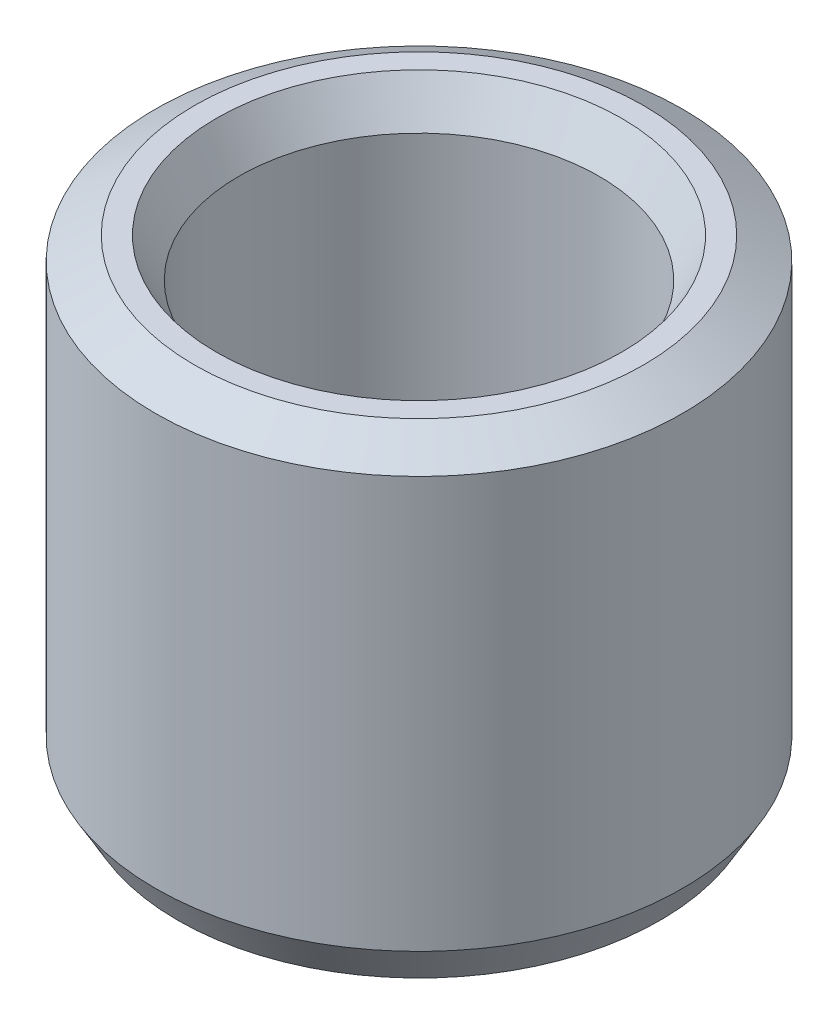
from build123d import *
from OCP.BRepFilletAPI import BRepFilletAPI_MakeChamfer

# Parameters (mm, degrees)
SKETCH1_R           = 37.5
BOSS_EXTRUDE1_DEPTH = 67.254759998
SKETCH2_R           = 25.626051789
CUT_EXTRUDE1_DEPTH  = 86.648717109
CHAMFER1_SIZE       = 3.199410828
CHAMFER1_SIZE2      = 5.541542108


with BuildPart() as part:
    # Sketch1 → Boss-Extrude1 (new body)
    with BuildSketch(Plane(origin=(0, 0, 0), x_dir=(1, 0, 0), z_dir=(0, 1, 0))):
        Circle(SKETCH1_R)
    extrude(amount=BOSS_EXTRUDE1_DEPTH)

    # Sketch2 → Cut-Extrude1 (cut, through all)
    with BuildSketch(Plane(origin=(0, 0, 0), x_dir=(1, 0, 0), z_dir=(0, 1, 0))):
        Circle(SKETCH2_R)
    extrude(amount=CUT_EXTRUDE1_DEPTH, mode=Mode.SUBTRACT)

    # Chamfer1: one chamfer whose edges measure the first distance from different faces: ONE call of the kernel's chamfer builder (chamfer() names one face for all edges)
    chamfer1_edges_1 = [part.edges().sort_by_distance(p)[0] for p in [
        (-25.626051789, 67.254759998, 0),
    ]]
    chamfer1_side_1 = [part.faces().sort_by_distance(p)[0] for p in [
        (-36.439339828, 67.254759998, 0),
    ]]
    chamfer1_edges_2 = [part.edges().sort_by_distance(p)[0] for p in [
        (-25.626051789, 0, 0),
    ]]
    chamfer1_side_2 = [part.faces().sort_by_distance(p)[0] for p in [
        (-25.626051789, 33.627379999, 0),
    ]]
    chamfer1_edges_3 = [part.edges().sort_by_distance(p)[0] for p in [
        (-37.5, 0, 0),
    ]]
    chamfer1_side_3 = [part.faces().sort_by_distance(p)[0] for p in [
        (-36.439339828, 0, 0),
    ]]
    chamfer1_edges_4 = [part.edges().sort_by_distance(p)[0] for p in [
        (-37.5, 67.254759998, 0),
    ]]
    chamfer1_side_4 = [part.faces().sort_by_distance(p)[0] for p in [
        (-37.5, 33.627379999, 0),
    ]]
    chamfer1 = BRepFilletAPI_MakeChamfer(part.part.solid().wrapped)
    for e in chamfer1_edges_1:
        chamfer1.Add(CHAMFER1_SIZE, CHAMFER1_SIZE2, e.wrapped, chamfer1_side_1[0].wrapped)  # the first distance lies on this face
    for e in chamfer1_edges_2:
        chamfer1.Add(CHAMFER1_SIZE, CHAMFER1_SIZE2, e.wrapped, chamfer1_side_2[0].wrapped)  # the first distance lies on this face
    for e in chamfer1_edges_3:
        chamfer1.Add(CHAMFER1_SIZE, CHAMFER1_SIZE2, e.wrapped, chamfer1_side_3[0].wrapped)  # the first distance lies on this face
    for e in chamfer1_edges_4:
        chamfer1.Add(CHAMFER1_SIZE, CHAMFER1_SIZE2, e.wrapped, chamfer1_side_4[0].wrapped)  # the first distance lies on this face
    add(Compound.cast(chamfer1.Shape()), mode=Mode.REPLACE)


solid = part.part
